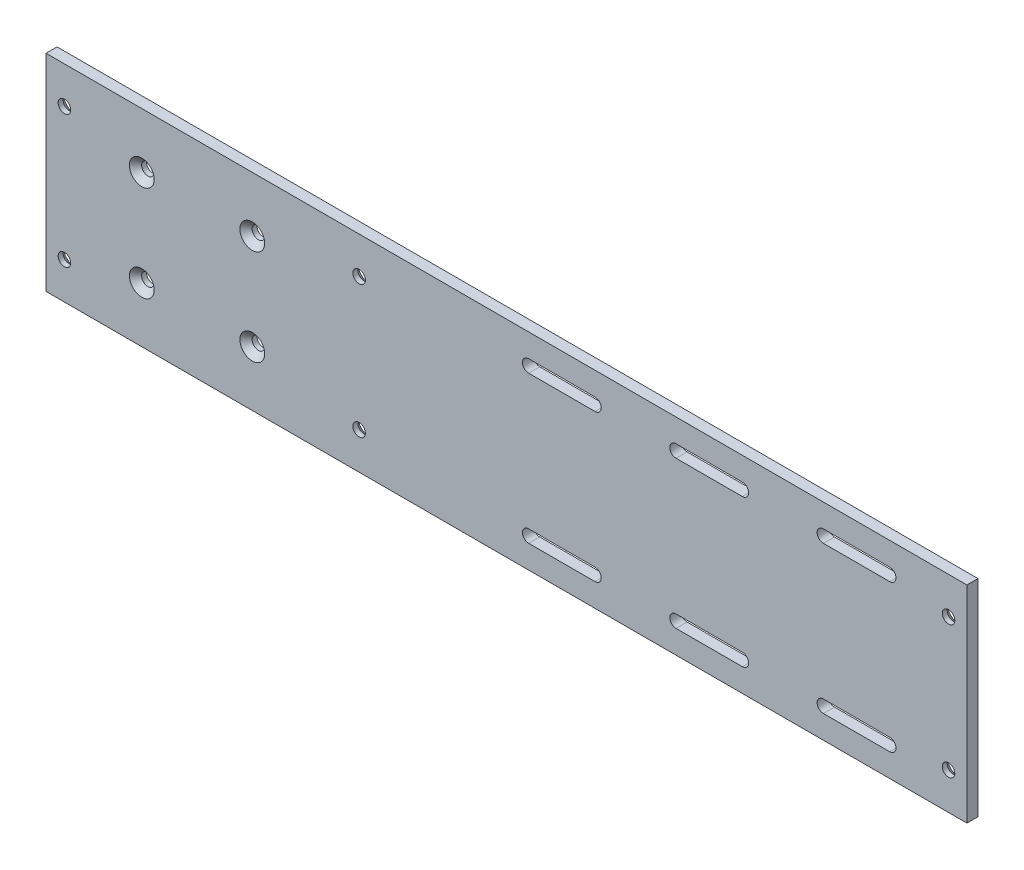
from build123d import *

# Parameters (mm, degrees)
SKETCH_1_W                 = 250
SKETCH_1_H                 = 56
EXTRUDE_1_DEPTH            = 3
HOLE_WIZARD_M32_AT_2_COUNT = 2
HOLE_WIZARD_M32_AT_2_PITCH = 26
HOLE_WIZARD_M32_AT_3_COUNT = 2
HOLE_WIZARD_M32_AT_3_PITCH = 39.698866483
HOLE_WIZARD_M32_AT_4_COUNT = 2
HOLE_WIZARD_M32_AT_4_PITCH = 30
HOLE_WIZARD_M31_AT_2_COUNT = 2
HOLE_WIZARD_M31_AT_2_PITCH = 36
HOLE_WIZARD_M31_AT_3_COUNT = 2
HOLE_WIZARD_M31_AT_3_PITCH = 240
HOLE_WIZARD_M31_AT_4_COUNT = 2
HOLE_WIZARD_M31_AT_4_PITCH = 242.684980994
HOLE_WIZARD_M31_AT_5_COUNT = 2
HOLE_WIZARD_M31_AT_5_PITCH = 80
HOLE_WIZARD_M31_AT_6_COUNT = 2
HOLE_WIZARD_M31_AT_6_PITCH = 87.726848798
CUT_EXTRUDE_3_DEPTH        = 129.132743668


with BuildPart() as part:
    # Эскиз1 → Бобышка-Вытянуть1 (new body)
    with BuildSketch(Plane.XY):
        Rectangle(SKETCH_1_W, SKETCH_1_H)
    extrude(amount=EXTRUDE_1_DEPTH)

    # Эскиз8 → Зенковка для  винта с потайной головкой с внутренним шестигранником M32 (revolve, cut)
    with BuildSketch(Plane(origin=(-99, 13, 3), x_dir=(0, -1, 0), z_dir=(1, 0, 0))):
        Polygon((0, 0), (0, 3), (1.7, 3), (1.7, 1.66), (3.36, 0), align=None)
    hole_wizard_m32 = revolve(axis=Axis((-99, 13, 9.35), (0, 0, -1)), mode=Mode.SUBTRACT)

    # Зенковка для  винта с потайной головкой с внутренним шестигранником M32 at 2: Зенковка для  винта с потайной головкой с внутренним шестигранником M32 ×2
    with Locations(*[(0, -i * HOLE_WIZARD_M32_AT_2_PITCH, 0) for i in range(1, HOLE_WIZARD_M32_AT_2_COUNT)]):
        add(hole_wizard_m32, mode=Mode.SUBTRACT)

    # Зенковка для  винта с потайной головкой с внутренним шестигранником M32 at 3: Зенковка для  винта с потайной головкой с внутренним шестигранником M32 ×2
    with Locations(*[Vector(0.7556890827898176, -0.6549305384178419, 0) * (i * HOLE_WIZARD_M32_AT_3_PITCH) for i in range(1, HOLE_WIZARD_M32_AT_3_COUNT)]):
        add(hole_wizard_m32, mode=Mode.SUBTRACT)

    # Зенковка для  винта с потайной головкой с внутренним шестигранником M32 at 4: Зенковка для  винта с потайной головкой с внутренним шестигранником M32 ×2
    with Locations(*[(i * HOLE_WIZARD_M32_AT_4_PITCH, 0, 0) for i in range(1, HOLE_WIZARD_M32_AT_4_COUNT)]):
        add(hole_wizard_m32, mode=Mode.SUBTRACT)

    # Эскиз5 → Зенковка для  винта с потайной головкой с внутренним шестигранником M31 (revolve, cut)
    with BuildSketch(Plane(origin=(-120, 18, 0), x_dir=(0, 1, 0), z_dir=(1, 0, 0))):
        Polygon((0, 0), (0, 3), (1.7, 3), (1.7, 1.66), (3.36, 0), align=None)
    hole_wizard_m31 = revolve(axis=Axis((-120, 18, -6.35), (0, 0, 1)), mode=Mode.SUBTRACT)

    # Зенковка для  винта с потайной головкой с внутренним шестигранником M31 at 2: Зенковка для  винта с потайной головкой с внутренним шестигранником M31 ×2
    with Locations(*[(0, -i * HOLE_WIZARD_M31_AT_2_PITCH, 0) for i in range(1, HOLE_WIZARD_M31_AT_2_COUNT)]):
        add(hole_wizard_m31, mode=Mode.SUBTRACT)

    # Зенковка для  винта с потайной головкой с внутренним шестигранником M31 at 3: Зенковка для  винта с потайной головкой с внутренним шестигранником M31 ×2
    with Locations(*[(i * HOLE_WIZARD_M31_AT_3_PITCH, 0, 0) for i in range(1, HOLE_WIZARD_M31_AT_3_COUNT)]):
        add(hole_wizard_m31, mode=Mode.SUBTRACT)

    # Зенковка для  винта с потайной головкой с внутренним шестигранником M31 at 4: Зенковка для  винта с потайной головкой с внутренним шестигранником M31 ×2
    with Locations(*[Vector(0.9889363528682976, -0.14834045293024464, 0) * (i * HOLE_WIZARD_M31_AT_4_PITCH) for i in range(1, HOLE_WIZARD_M31_AT_4_COUNT)]):
        add(hole_wizard_m31, mode=Mode.SUBTRACT)

    # Зенковка для  винта с потайной головкой с внутренним шестигранником M31 at 5: Зенковка для  винта с потайной головкой с внутренним шестигранником M31 ×2
    with Locations(*[(i * HOLE_WIZARD_M31_AT_5_PITCH, 0, 0) for i in range(1, HOLE_WIZARD_M31_AT_5_COUNT)]):
        add(hole_wizard_m31, mode=Mode.SUBTRACT)

    # Зенковка для  винта с потайной головкой с внутренним шестигранником M31 at 6: Зенковка для  винта с потайной головкой с внутренним шестигранником M31 ×2
    with Locations(*[Vector(0.9119215051751064, -0.4103646773287979, 0) * (i * HOLE_WIZARD_M31_AT_6_PITCH) for i in range(1, HOLE_WIZARD_M31_AT_6_COUNT)]):
        add(hole_wizard_m31, mode=Mode.SUBTRACT)

    # Эскиз7 → Вырез-Вытянуть3 (cut, through all)
    with BuildSketch(Plane.XY.offset(3)):
        with BuildLine():
            Line((6.030531049, 21.7), (24.030531049, 21.7))
            ThreePointArc((24.030531049, 21.7), (25.730531049, 20), (24.030531049, 18.3))
            Line((24.030531049, 18.3), (6.030531049, 18.3))
            ThreePointArc((6.030531049, 18.3), (4.330531049, 20), (6.030531049, 21.7))
        make_face()
        with BuildLine():
            Line((46.030531049, 21.7), (64.030531049, 21.7))
            ThreePointArc((64.030531049, 21.7), (65.730531049, 20), (64.030531049, 18.3))
            Line((64.030531049, 18.3), (46.030531049, 18.3))
            ThreePointArc((46.030531049, 18.3), (44.330531049, 20), (46.030531049, 21.7))
        make_face()
        with BuildLine():
            Line((86.030531049, 21.7), (104.030531049, 21.7))
            ThreePointArc((104.030531049, 21.7), (105.730531049, 20), (104.030531049, 18.3))
            Line((104.030531049, 18.3), (86.030531049, 18.3))
            ThreePointArc((86.030531049, 18.3), (84.330531049, 20), (86.030531049, 21.7))
        make_face()
        with BuildLine():
            Line((6.030531049, -18.3), (24.030531049, -18.3))
            ThreePointArc((24.030531049, -18.3), (25.730531049, -20), (24.030531049, -21.7))
            Line((24.030531049, -21.7), (6.030531049, -21.7))
            ThreePointArc((6.030531049, -21.7), (4.330531049, -20), (6.030531049, -18.3))
        make_face()
        with BuildLine():
            Line((46.030531049, -18.3), (64.030531049, -18.3))
            ThreePointArc((64.030531049, -18.3), (65.730531049, -20), (64.030531049, -21.7))
            Line((64.030531049, -21.7), (46.030531049, -21.7))
            ThreePointArc((46.030531049, -21.7), (44.330531049, -20), (46.030531049, -18.3))
        make_face()
        with BuildLine():
            Line((86.030531049, -18.3), (104.030531049, -18.3))
            ThreePointArc((104.030531049, -18.3), (105.730531049, -20), (104.030531049, -21.7))
            Line((104.030531049, -21.7), (86.030531049, -21.7))
            ThreePointArc((86.030531049, -21.7), (84.330531049, -20), (86.030531049, -18.3))
        make_face()
    extrude(amount=-CUT_EXTRUDE_3_DEPTH, mode=Mode.SUBTRACT)


solid = part.part
